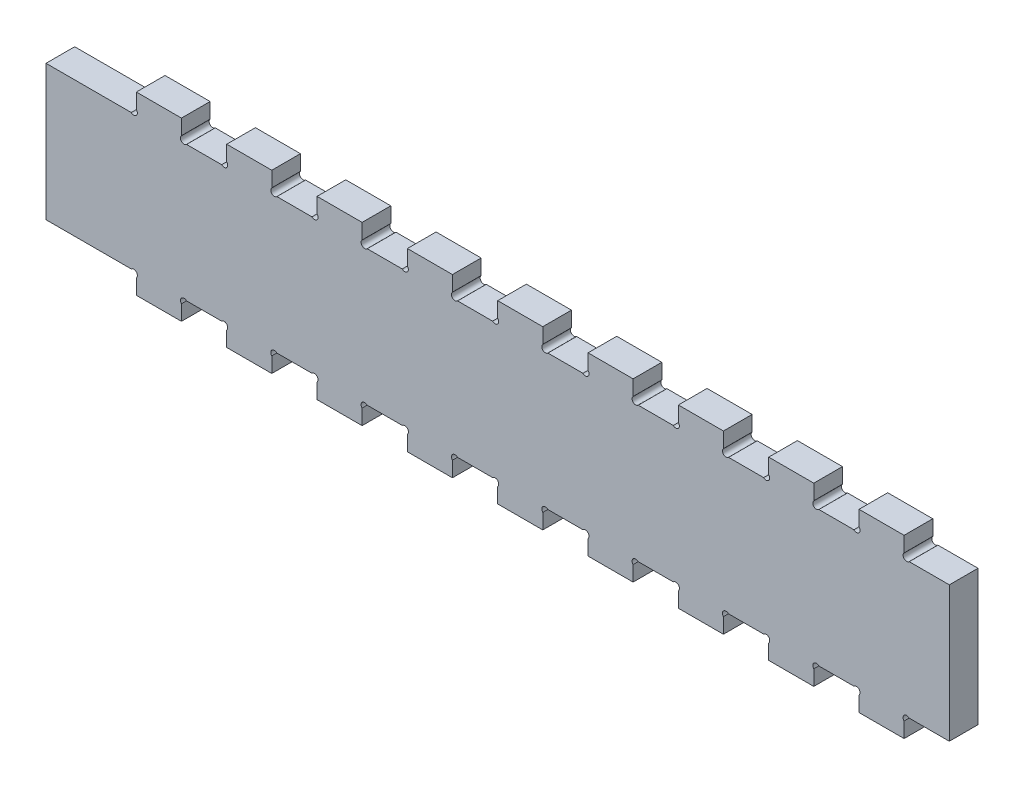
from build123d import *

# Parameters (mm, degrees)
BOSS_EXTRUDE1_DEPTH = 6.35
SKETCH2_W           = 10.0254
SKETCH2_H           = 4.477133961
CUT_EXTRUDE2_DEPTH  = 204.051450213
LPATTERN1_COUNT     = 9
LPATTERN1_PITCH     = 20
SKETCH3_W           = 0.405797101
SKETCH3_H           = 2.992753624
CUT_EXTRUDE3_DEPTH  = 2.54


# Read off the part's stored shape, not the designer's step: Boss-Extrude1
with BuildPart() as part:
    # Boss-Extrude1 outline → Boss-Extrude1 (new body)
    with BuildSketch(Plane.XY):
        with BuildLine():
            Line((190, -4.490128061), (190, -1.122532015))
            ThreePointArc((190, -1.122532015), (190, 0), (191.122532015, 0))
            Line((191.122532015, 0), (200, 0))
            Line((200, 0), (200, 30))
            Line((200, 30), (191.122532015, 30))
            ThreePointArc((191.122532015, 30), (190, 30), (190, 31.122532015))
            Line((190, 31.122532015), (190, 34.490128061))
            Line((190, 34.490128061), (180, 34.490128061))
            Line((180, 34.490128061), (180, 31.122532015))
            ThreePointArc((180, 31.122532015), (180, 30), (178.877467985, 30))
            Line((178.877467985, 30), (171.122532015, 30))
            ThreePointArc((171.122532015, 30), (170, 30), (170, 31.122532015))
            Line((170, 31.122532015), (170, 34.490128061))
            Line((170, 34.490128061), (160, 34.490128061))
            Line((160, 34.490128061), (160, 31.122532015))
            ThreePointArc((160, 31.122532015), (160, 30), (158.877467985, 30))
            Line((158.877467985, 30), (151.122532015, 30))
            ThreePointArc((151.122532015, 30), (150, 30), (150, 31.122532015))
            Line((150, 31.122532015), (150, 34.490128061))
            Line((150, 34.490128061), (140, 34.490128061))
            Line((140, 34.490128061), (140, 31.122532015))
            ThreePointArc((140, 31.122532015), (140, 30), (138.877467985, 30))
            Line((138.877467985, 30), (131.122532015, 30))
            ThreePointArc((131.122532015, 30), (130, 30), (130, 31.122532015))
            Line((130, 31.122532015), (130, 34.490128061))
            Line((130, 34.490128061), (120, 34.490128061))
            Line((120, 34.490128061), (120, 31.122532015))
            ThreePointArc((120, 31.122532015), (120, 30), (118.877467985, 30))
            Line((118.877467985, 30), (111.122532015, 30))
            ThreePointArc((111.122532015, 30), (110, 30), (110, 31.122532015))
            Line((110, 31.122532015), (110, 34.490128061))
            Line((110, 34.490128061), (100, 34.490128061))
            Line((100, 34.490128061), (100, 31.122532015))
            ThreePointArc((100, 31.122532015), (100, 30), (98.877467985, 30))
            Line((98.877467985, 30), (91.122532015, 30))
            ThreePointArc((91.122532015, 30), (90, 30), (90, 31.122532015))
            Line((90, 31.122532015), (90, 34.490128061))
            Line((90, 34.490128061), (80, 34.490128061))
            Line((80, 34.490128061), (80, 31.122532015))
            ThreePointArc((80, 31.122532015), (80, 30), (78.877467985, 30))
            Line((78.877467985, 30), (71.122532015, 30))
            ThreePointArc((71.122532015, 30), (70, 30), (70, 31.122532015))
            Line((70, 31.122532015), (70, 34.490128061))
            Line((70, 34.490128061), (60, 34.490128061))
            Line((60, 34.490128061), (60, 31.122532015))
            ThreePointArc((60, 31.122532015), (60, 30), (58.877467985, 30))
            Line((58.877467985, 30), (51.122532015, 30))
            ThreePointArc((51.122532015, 30), (50, 30), (50, 31.122532015))
            Line((50, 31.122532015), (50, 34.490128061))
            Line((50, 34.490128061), (40, 34.490128061))
            Line((40, 34.490128061), (40, 31.122532015))
            ThreePointArc((40, 31.122532015), (40, 30), (38.877467985, 30))
            Line((38.877467985, 30), (31.122532015, 30))
            ThreePointArc((31.122532015, 30), (30, 30), (30, 31.122532015))
            Line((30, 31.122532015), (30, 34.490128061))
            Line((30, 34.490128061), (20, 34.490128061))
            Line((20, 34.490128061), (20, 31.122532015))
            ThreePointArc((20, 31.122532015), (20, 30), (18.877467985, 30))
            Line((18.877467985, 30), (0, 30))
            Line((0, 30), (0, 0))
            Line((0, 0), (18.877467985, 0))
            ThreePointArc((18.877467985, 0), (20, 0), (20, -1.122532015))
            Line((20, -1.122532015), (20, -4.490128061))
            Line((20, -4.490128061), (30, -4.490128061))
            Line((30, -4.490128061), (30, -1.122532015))
            ThreePointArc((30, -1.122532015), (30, 0), (31.122532015, 0))
            Line((31.122532015, 0), (38.877467985, 0))
            ThreePointArc((38.877467985, 0), (40, 0), (40, -1.122532015))
            Line((40, -1.122532015), (40, -4.490128061))
            Line((40, -4.490128061), (50, -4.490128061))
            Line((50, -4.490128061), (50, -1.122532015))
            ThreePointArc((50, -1.122532015), (50, 0), (51.122532015, 0))
            Line((51.122532015, 0), (58.877467985, 0))
            ThreePointArc((58.877467985, 0), (60, 0), (60, -1.122532015))
            Line((60, -1.122532015), (60, -4.490128061))
            Line((60, -4.490128061), (70, -4.490128061))
            Line((70, -4.490128061), (70, -1.122532015))
            ThreePointArc((70, -1.122532015), (70, 0), (71.122532015, 0))
            Line((71.122532015, 0), (78.877467985, 0))
            ThreePointArc((78.877467985, 0), (80, 0), (80, -1.122532015))
            Line((80, -1.122532015), (80, -4.490128061))
            Line((80, -4.490128061), (90, -4.490128061))
            Line((90, -4.490128061), (90, -1.122532015))
            ThreePointArc((90, -1.122532015), (90, 0), (91.122532015, 0))
            Line((91.122532015, 0), (98.877467985, 0))
            ThreePointArc((98.877467985, 0), (100, 0), (100, -1.122532015))
            Line((100, -1.122532015), (100, -4.490128061))
            Line((100, -4.490128061), (110, -4.490128061))
            Line((110, -4.490128061), (110, -1.122532015))
            ThreePointArc((110, -1.122532015), (110, 0), (111.122532015, 0))
            Line((111.122532015, 0), (118.877467985, 0))
            ThreePointArc((118.877467985, 0), (120, 0), (120, -1.122532015))
            Line((120, -1.122532015), (120, -4.490128061))
            Line((120, -4.490128061), (130, -4.490128061))
            Line((130, -4.490128061), (130, -1.122532015))
            ThreePointArc((130, -1.122532015), (130, 0), (131.122532015, 0))
            Line((131.122532015, 0), (138.877467985, 0))
            ThreePointArc((138.877467985, 0), (140, 0), (140, -1.122532015))
            Line((140, -1.122532015), (140, -4.490128061))
            Line((140, -4.490128061), (150, -4.490128061))
            Line((150, -4.490128061), (150, -1.122532015))
            ThreePointArc((150, -1.122532015), (150, 0), (151.122532015, 0))
            Line((151.122532015, 0), (158.877467985, 0))
            ThreePointArc((158.877467985, 0), (160, 0), (160, -1.122532015))
            Line((160, -1.122532015), (160, -4.490128061))
            Line((160, -4.490128061), (170, -4.490128061))
            Line((170, -4.490128061), (170, -1.122532015))
            ThreePointArc((170, -1.122532015), (170, 0), (171.122532015, 0))
            Line((171.122532015, 0), (178.877467985, 0))
            ThreePointArc((178.877467985, 0), (180, 0), (180, -1.122532015))
            Line((180, -1.122532015), (180, -4.490128061))
            Line((180, -4.490128061), (190, -4.490128061))
        make_face()
    extrude(amount=BOSS_EXTRUDE1_DEPTH)

    # Sketch2 → Cut-Extrude2 (cut, through all)
    with BuildSketch(Plane(origin=(0, 0, 0), x_dir=(-1, 0, 0), z_dir=(0, 0, -1))):
        with Locations((-35, 32.25156108)):
            Rectangle(SKETCH2_W, SKETCH2_H)
        with Locations((-35, -2.251561081)):
            Rectangle(SKETCH2_W, SKETCH2_H)
    cut_extrude2 = extrude(amount=-CUT_EXTRUDE2_DEPTH, mode=Mode.SUBTRACT)

    # LPattern1: Cut-Extrude2 ×9
    with Locations(*[(i * LPATTERN1_PITCH, 0, 0) for i in range(1, LPATTERN1_COUNT)]):
        add(cut_extrude2, mode=Mode.SUBTRACT)

    # Sketch3 → Cut-Extrude3 (cut)
    # profile 1 of 6: a face of its own
    with BuildSketch(Plane(origin=(0, 0, 0), x_dir=(-1, 0, 0), z_dir=(0, 0, -1))):
        with BuildLine():
            add(Edge.make_bspline(
                [(-198.628550725, 27.362318841), (-198.652091106, 27.431945135), (-198.699135289, 27.571089524), (-198.745555146, 27.787113594), (-198.775410316, 28.007421408), (-198.778944977, 28.156113537), (-198.780724638, 28.230978261)],
                knots=[0, 0, 0, 0, 0.994488486, 1.987431555, 2.986695647, 4, 4, 4, 4], degree=3))
            add(Edge.make_bspline(
                [(-198.780724638, 28.230978261), (-198.779347085, 28.290214576), (-198.776663168, 28.405626081), (-198.756085396, 28.573415785), (-198.721119452, 28.730498487), (-198.673168798, 28.877228454), (-198.610110067, 29.013181761), (-198.532689936, 29.138296678), (-198.441960032, 29.253151675), (-198.337221232, 29.357057247), (-198.218447884, 29.449217406), (-198.086243147, 29.529368256), (-197.940656127, 29.597230558), (-197.781519009, 29.6512293), (-197.609441868, 29.693995686), (-197.424480067, 29.724570293), (-197.226065436, 29.742834767), (-197.089415041, 29.745170448), (-197.018836051, 29.746376812)],
                knots=[0, 0, 0, 0, 1.072521388, 2.089618652, 3.055324458, 3.982727964, 4.879567488, 5.762479147, 6.641155072, 7.524105616, 8.427505607, 9.357127668, 10.318129176, 11.330308756, 12.395495865, 13.525717698, 14.722050183, 16, 16, 16, 16], degree=3))
            add(Edge.make_bspline(
                [(-197.018836051, 29.746376812), (-196.950103159, 29.744909398), (-196.815516836, 29.742036046), (-196.618803095, 29.722459574), (-196.432233617, 29.688304207), (-196.256545532, 29.640879855), (-196.091928662, 29.58173503), (-195.939702067, 29.510339818), (-195.800493439, 29.427031038), (-195.674329672, 29.332409553), (-195.561855768, 29.226124214), (-195.462239526, 29.109506384), (-195.377108527, 28.981556585), (-195.305406147, 28.844117393), (-195.248937918, 28.696813536), (-195.208791146, 28.540475902), (-195.183349726, 28.375530844), (-195.180652245, 28.262511932), (-195.179275362, 28.20482337)],
                knots=[0, 0, 0, 0, 1.219601586, 2.388109825, 3.503461938, 4.581531402, 5.613672394, 6.603499858, 7.560235823, 8.487517701, 9.396185618, 10.300781163, 11.203126632, 12.117328385, 13.046279645, 13.9957175, 14.976948417, 16, 16, 16, 16], degree=3))
            add(Edge.make_bspline(
                [(-195.179275362, 28.20482337), (-195.17969203, 28.165444993), (-195.180512088, 28.08794313), (-195.188153972, 27.974028922), (-195.198571411, 27.864134749), (-195.221082705, 27.724732816), (-195.25962679, 27.555564684), (-195.307559555, 27.426596609), (-195.331449275, 27.362318841)],
                knots=[0, 0, 0, 0, 0.822626155, 1.619037258, 2.384688107, 3.12792479, 4.568555946, 6, 6, 6, 6], degree=3))
            Line((-195.331449275, 27.362318841), (-195.787971014, 27.362318841))
            add(Edge.make_bspline(
                [(-195.787971014, 27.362318841), (-195.771985551, 27.393569026), (-195.740307718, 27.455496426), (-195.699927539, 27.551481993), (-195.664844647, 27.648729232), (-195.63631946, 27.748614059), (-195.612971413, 27.851451734), (-195.59632813, 27.958668498), (-195.586881132, 28.070441354), (-195.585681673, 28.146419535), (-195.585072464, 28.185009058)],
                knots=[0, 0, 0, 0, 0.983572694, 1.949111623, 2.916466222, 3.879730749, 4.858833143, 5.870548135, 6.918445666, 8, 8, 8, 8], degree=3))
            add(Edge.make_bspline(
                [(-195.585072464, 28.185009058), (-195.585947203, 28.224454608), (-195.58766552, 28.301940529), (-195.606833914, 28.414803354), (-195.635816185, 28.522142523), (-195.677440027, 28.623103012), (-195.729539701, 28.717931635), (-195.793789159, 28.804786402), (-195.867958619, 28.884568583), (-195.952664586, 28.956889446), (-196.047006936, 29.022104527), (-196.152107873, 29.078237948), (-196.26639413, 29.12780325), (-196.391146352, 29.16738308), (-196.524711114, 29.200399224), (-196.667626451, 29.222848281), (-196.819636076, 29.236403656), (-196.923962023, 29.23820428), (-196.977622283, 29.239130435)],
                knots=[0, 0, 0, 0, 0.961465539, 1.888680529, 2.784722735, 3.669285122, 4.546395053, 5.417897658, 6.298128314, 7.19861075, 8.13011739, 9.090545283, 10.101099583, 11.165124917, 12.279780303, 13.454963993, 14.690955624, 16, 16, 16, 16], degree=3))
            add(Edge.make_bspline(
                [(-196.977622283, 29.239130435), (-197.03365404, 29.238473676), (-197.142173332, 29.237201701), (-197.299710917, 29.224474169), (-197.446551705, 29.202973842), (-197.583433317, 29.174711318), (-197.708874063, 29.134997331), (-197.824889035, 29.090106589), (-197.929117691, 29.033873533), (-198.023311652, 28.97066931), (-198.106482041, 28.898914598), (-198.17860395, 28.818751954), (-198.239913979, 28.730757522), (-198.289142503, 28.634260317), (-198.328612289, 28.530794458), (-198.354730778, 28.418789268), (-198.372063314, 28.299416088), (-198.373955209, 28.217041513), (-198.374927536, 28.174705616)],
                knots=[0, 0, 0, 0, 1.344734694, 2.604409767, 3.789983137, 4.905641868, 5.954647261, 6.944970549, 7.886844079, 8.790877712, 9.663034665, 10.516172657, 11.372838457, 12.229363423, 13.110351235, 14.023942263, 14.984417489, 16, 16, 16, 16], degree=3))
            add(Edge.make_bspline(
                [(-198.374927536, 28.174705616), (-198.374407016, 28.138219623), (-198.373375149, 28.065890758), (-198.36240331, 27.958463684), (-198.346128184, 27.853321545), (-198.315197481, 27.716783036), (-198.261925741, 27.550622139), (-198.202009226, 27.425117304), (-198.172028986, 27.362318841)],
                knots=[0, 0, 0, 0, 0.776679327, 1.539668523, 2.297162527, 3.040996235, 4.519412489, 6, 6, 6, 6], degree=3))
            Line((-198.172028986, 27.362318841), (-198.628550725, 27.362318841))
        make_face()
    # profile 2 of 6: a face of its own
    with BuildSketch(Plane(origin=(0, 0, 0), x_dir=(-1, 0, 0), z_dir=(0, 0, -1))):
        Polygon((-195.635797101, 24.471014493), (-195.635797101, 25.942028986), (-196.75173913, 25.942028986), (-196.75173913, 24.548686594), (-197.157536232, 24.548686594), (-197.157536232, 25.942028986), (-198.73, 25.942028986), (-198.73, 26.449275362), (-195.23, 26.449275362), (-195.23, 24.471014493), align=None)
    # profile 3 of 6: a face of its own
    with BuildSketch(Plane(origin=(0, 0, 0), x_dir=(-1, 0, 0), z_dir=(0, 0, -1))):
        with Locations((-199.643043479, 22.518115942)):
            Rectangle(SKETCH3_W, SKETCH3_H)
    # profile 4 of 6: a face of its own
    with BuildSketch(Plane(origin=(0, 0, 0), x_dir=(-1, 0, 0), z_dir=(0, 0, -1))):
        with BuildLine():
            add(Edge.make_bspline(
                [(-197.670330616, 18.333333333), (-197.711612614, 18.334552719), (-197.792216556, 18.336933594), (-197.909249857, 18.355417592), (-198.019065336, 18.385723084), (-198.121839201, 18.427494563), (-198.216637962, 18.482176595), (-198.304068686, 18.54654767), (-198.384381979, 18.620818301), (-198.455513732, 18.706244464), (-198.51919145, 18.801097031), (-198.574739862, 18.905540337), (-198.622031599, 19.019229845), (-198.661808726, 19.141615391), (-198.692251736, 19.27238396), (-198.714580498, 19.410586903), (-198.726968847, 19.556046201), (-198.728974678, 19.655321984), (-198.73, 19.706068841)],
                knots=[0, 0, 0, 0, 1.013018926, 1.977940103, 2.899955204, 3.804400801, 4.693250329, 5.579161346, 6.464787474, 7.371531952, 8.301450184, 9.264691813, 10.270398083, 11.320438124, 12.419978944, 13.562918785, 14.754235849, 16, 16, 16, 16], degree=3))
            Line((-198.73, 19.706068841), (-198.73, 20.615942029))
            Line((-198.73, 20.615942029), (-195.23, 20.615942029))
            Line((-195.23, 20.615942029), (-195.23, 19.610167572))
            add(Edge.make_bspline(
                [(-195.23, 19.610167572), (-195.230464431, 19.562588734), (-195.231363518, 19.470481221), (-195.242332986, 19.337211073), (-195.257481278, 19.212954813), (-195.280106274, 19.097839127), (-195.310691576, 18.992125316), (-195.345594289, 18.89479407), (-195.388573847, 18.80718118), (-195.438041268, 18.72883437), (-195.49346427, 18.658972224), (-195.556862535, 18.599298893), (-195.626055454, 18.547964043), (-195.702465498, 18.50648939), (-195.78520507, 18.473880647), (-195.874661369, 18.451041988), (-195.970378, 18.437528747), (-196.036265702, 18.435714823), (-196.070126812, 18.434782609)],
                knots=[0, 0, 0, 0, 1.388776146, 2.688521212, 3.90167895, 5.042289038, 6.109239049, 7.11226345, 8.057476407, 8.951978552, 9.813306123, 10.653548746, 11.486644475, 12.322022467, 13.184316581, 14.076721024, 15.011585489, 16, 16, 16, 16], degree=3))
            add(Edge.make_bspline(
                [(-196.070126812, 18.434782609), (-196.115169303, 18.436403414), (-196.202835642, 18.439557994), (-196.329399337, 18.465639236), (-196.446577475, 18.507397475), (-196.53556389, 18.557498888), (-196.60056413, 18.606158591), (-196.645876751, 18.648499602), (-196.688040958, 18.696299536), (-196.726676338, 18.749579351), (-196.76262516, 18.80777413), (-196.79501487, 18.871460145), (-196.824350956, 18.940341775), (-196.840816409, 18.988675701), (-196.849225543, 19.013360507)],
                knots=[0, 0, 0, 0, 1.541977986, 3.001156466, 4.407060406, 5.789131498, 6.480670747, 7.18517987, 7.909811226, 8.661142727, 9.437360888, 10.251042573, 11.106783222, 12, 12, 12, 12], degree=3))
            add(Edge.make_bspline(
                [(-196.849225543, 19.013360507), (-196.860065748, 18.968308646), (-196.881771568, 18.878099308), (-196.928561348, 18.771581965), (-196.975223426, 18.691895954), (-197.014775091, 18.635497038), (-197.05940559, 18.583045664), (-197.108472709, 18.534434077), (-197.162965808, 18.490877734), (-197.221349721, 18.450795882), (-197.285595878, 18.417138056), (-197.353443955, 18.386401216), (-197.426627104, 18.36298943), (-197.503983515, 18.345306606), (-197.585769312, 18.334915485), (-197.641768506, 18.333867734), (-197.670330616, 18.333333333)],
                knots=[0, 0, 0, 0, 1.670616822, 3.345150051, 4.174542402, 5.002837093, 5.828436346, 6.658048056, 7.492252958, 8.344102667, 9.210408142, 10.107210083, 11.030208826, 11.978920865, 12.969158656, 14, 14, 14, 14], degree=3))
        make_face()
        with BuildLine():
            add(Edge.make_bspline(
                [(-196.135910326, 18.942028986), (-196.102000441, 18.943639727), (-196.035484239, 18.94679929), (-195.954216254, 18.965505647), (-195.894466481, 18.991188927), (-195.852363798, 19.015236292), (-195.814691046, 19.046524041), (-195.779124872, 19.082316272), (-195.747617631, 19.125413908), (-195.719736962, 19.175292416), (-195.695523102, 19.231727751), (-195.673661302, 19.295143426), (-195.656579572, 19.366518532), (-195.643799446, 19.446498844), (-195.637105454, 19.535021712), (-195.636245058, 19.596948014), (-195.635797101, 19.629189312)],
                knots=[0, 0, 0, 0, 1.467045884, 2.877695405, 3.573867127, 4.275456608, 4.966073554, 5.685215822, 6.453088758, 7.266618696, 8.151857393, 9.105814358, 10.164476173, 11.321657456, 12.605548258, 14, 14, 14, 14], degree=3))
            Line((-195.635797101, 19.629189312), (-195.635797101, 20.108695652))
            Line((-195.635797101, 20.108695652), (-196.701014493, 20.108695652))
            Line((-196.701014493, 20.108695652), (-196.701014493, 19.645040761))
            add(Edge.make_bspline(
                [(-196.701014493, 19.645040761), (-196.699390896, 19.594467097), (-196.696284113, 19.497693422), (-196.675211495, 19.380618164), (-196.650521284, 19.295216614), (-196.624597327, 19.238009317), (-196.598138277, 19.183484005), (-196.563980058, 19.135305667), (-196.527033405, 19.091003526), (-196.484374355, 19.053077934), (-196.438297953, 19.019191508), (-196.38703856, 18.991470717), (-196.331286841, 18.969035286), (-196.270554208, 18.953384684), (-196.204914458, 18.943656037), (-196.159459434, 18.942584251), (-196.135910326, 18.942028986)],
                knots=[0, 0, 0, 0, 2.07319733, 3.967102795, 4.861818127, 5.711290337, 6.540050836, 7.342609058, 8.126589253, 8.901454404, 9.677455332, 10.467924367, 11.284911594, 12.136523798, 13.034579709, 14, 14, 14, 14], degree=3))
        make_face(mode=Mode.SUBTRACT)
        with BuildLine():
            add(Edge.make_bspline(
                [(-197.688559783, 18.84057971), (-197.66658319, 18.841081562), (-197.623432371, 18.842066944), (-197.5605164, 18.85300441), (-197.500652434, 18.869108308), (-197.444763888, 18.893539072), (-197.392278926, 18.923327628), (-197.34424528, 18.96037642), (-197.300721536, 19.003511209), (-197.260554534, 19.052006809), (-197.225978128, 19.10725161), (-197.195019011, 19.167733518), (-197.167984737, 19.233669478), (-197.145907024, 19.305310729), (-197.128731037, 19.381935375), (-197.11608915, 19.463474482), (-197.107905726, 19.549500399), (-197.107181255, 19.608563322), (-197.106811594, 19.638700181)],
                knots=[0, 0, 0, 0, 0.948095207, 1.861575377, 2.750206076, 3.619134704, 4.488063333, 5.350676771, 6.230103954, 7.1300163, 8.063722535, 9.038358162, 10.061729227, 11.137140004, 12.271978643, 13.449987923, 14.698856227, 16, 16, 16, 16], degree=3))
            Line((-197.106811594, 19.638700181), (-197.106811594, 20.108695652))
            Line((-197.106811594, 20.108695652), (-198.324202899, 20.108695652))
            Line((-198.324202899, 20.108695652), (-198.324202899, 19.622848732))
            add(Edge.make_bspline(
                [(-198.324202899, 19.622848732), (-198.323795744, 19.590864998), (-198.323010621, 19.529190182), (-198.315615433, 19.439757765), (-198.30436585, 19.356449019), (-198.286554148, 19.279524495), (-198.265484613, 19.208587576), (-198.239583094, 19.143727693), (-198.207495631, 19.08594066), (-198.171973312, 19.033409871), (-198.130045145, 18.987863376), (-198.083146098, 18.94786567), (-198.030299067, 18.914306609), (-197.971958358, 18.887670143), (-197.908889412, 18.865889358), (-197.840256309, 18.851079252), (-197.766189239, 18.842457535), (-197.715002724, 18.841219354), (-197.688559783, 18.84057971)],
                knots=[0, 0, 0, 0, 1.326220392, 2.557374965, 3.719554304, 4.809389662, 5.828461835, 6.78681947, 7.698897868, 8.565135202, 9.410540238, 10.257931127, 11.115112254, 11.997484581, 12.912257456, 13.877294056, 14.903410591, 16, 16, 16, 16], degree=3))
        make_face(mode=Mode.SUBTRACT)
    # profile 5 of 6: a face of its own
    with BuildSketch(Plane(origin=(0, 0, 0), x_dir=(-1, 0, 0), z_dir=(0, 0, -1))):
        Polygon((-195.635797101, 16.760869565), (-195.635797101, 17.572463768), (-195.23, 17.572463768), (-195.23, 15.442028986), (-195.635797101, 15.442028986), (-195.635797101, 16.253623188), (-198.324202899, 16.253623188), (-198.324202899, 15.442028986), (-198.73, 15.442028986), (-198.73, 17.572463768), (-198.324202899, 17.572463768), (-198.324202899, 16.760869565), align=None)
    # profile 6 of 6: a face of its own
    with BuildSketch(Plane(origin=(0, 0, 0), x_dir=(-1, 0, 0), z_dir=(0, 0, -1))):
        Polygon((-195.635797101, 12.246376812), (-195.635797101, 13.260869565), (-198.73, 13.260869565), (-198.73, 13.768115942), (-195.635797101, 13.768115942), (-195.635797101, 14.782608696), (-195.23, 14.782608696), (-195.23, 12.246376812), align=None)
    extrude(amount=-CUT_EXTRUDE3_DEPTH, mode=Mode.SUBTRACT)


solid = part.part
